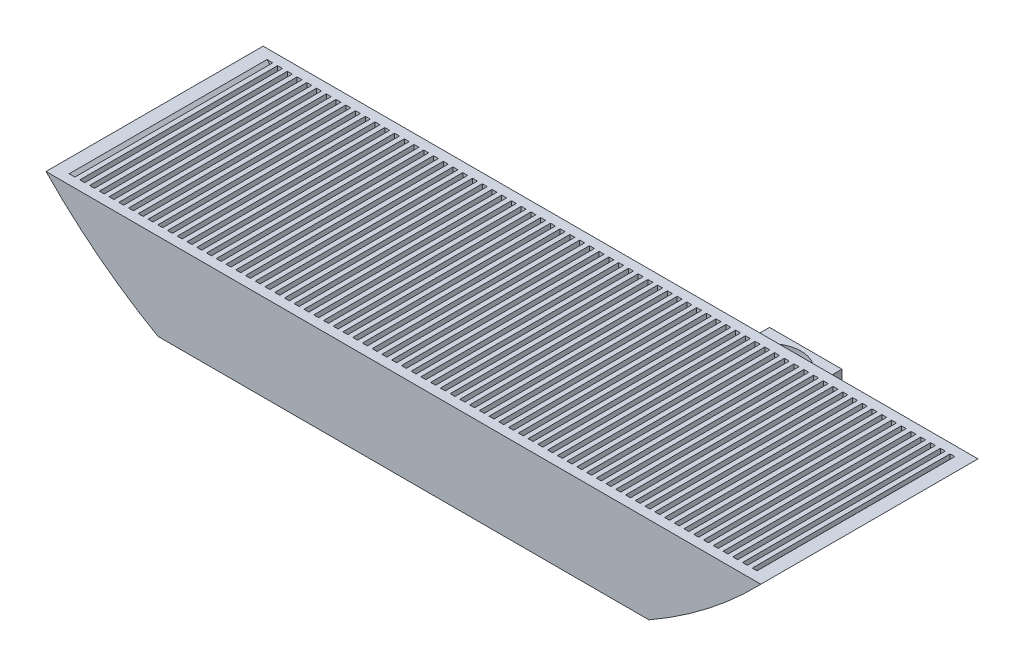
from build123d import *

# Parameters (mm, degrees)
BOSS_EXTRU_1_DEPTH         = 45
COQUE1_T                   = -2
BOSS_EXTRU_4_DEPTH         = 41
R_P_TITION_LIN_AIRE1_COUNT = 70
R_P_TITION_LIN_AIRE1_PITCH = 2.02
ESQUISSE3_W                = 15
ESQUISSE3_H                = 15
ESQUISSE3_R                = 6.5
BOSS_EXTRU_5_DEPTH         = 5
CONG_1_R                   = 0.25


with BuildPart() as part:
    # Esquisse1 → Boss.-Extru.1 (new body)
    with BuildSketch(Plane.XY):
        with BuildLine():
            Line((-50.330657344, -8.37745098), (51.422641976, -8.37745098))
            ThreePointArc((51.422641976, -8.37745098), (63.67142232, -0.208901476), (74.630455219, 9.62254902))
            Line((74.630455219, 9.62254902), (31.241812865, 9.62254902))
            Line((31.241812865, 9.62254902), (12.241812865, 9.62254902))
            Line((12.241812865, 9.62254902), (-73.538470588, 9.62254902))
            ThreePointArc((-73.538470588, 9.62254902), (-62.579437689, -0.208901476), (-50.330657344, -8.37745098))
        make_face()
    extrude(amount=BOSS_EXTRU_1_DEPTH)

    # Coque1
    coque1_openings = [part.faces().sort_by_distance(p)[0] for p in [
        (0.545992316, 9.62254902, 22.5),
        (0.545992316, -8.37745098, 22.5),
    ]]
    offset(amount=COQUE1_T, openings=coque1_openings, kind=Kind.INTERSECTION)

    # Esquisse2 → Boss.-Extru.4 (add)
    with BuildSketch(Plane.XY.offset(2)):
        with BuildLine():
            Line((-68.538470588, 9.62254902), (-69.538470588, 9.62254902))
            Line((-69.538470588, 9.62254902), (-69.538470588, 8.453497891))
            ThreePointArc((-69.538470588, 8.453497891), (-69.103392513, 8.036722078), (-68.665836017, 7.62254902))
            Line((-68.665836017, 7.62254902), (-68.538470588, 7.62254902))
            Line((-68.538470588, 7.62254902), (-68.538470588, 9.62254902))
        make_face()
    boss_extru_4 = extrude(amount=BOSS_EXTRU_4_DEPTH)

    # Répétition linéaire1: Boss.-Extru.4 ×70
    with Locations(*[(i * R_P_TITION_LIN_AIRE1_PITCH, 0, 0) for i in range(1, R_P_TITION_LIN_AIRE1_COUNT)]):
        add(boss_extru_4)

    # Esquisse3 → Boss.-Extru.5 (add)
    with BuildSketch(Plane.XZ.offset(8.37745098)):
        with Locations((23.922641976, -7.5)):
            Rectangle(ESQUISSE3_W, ESQUISSE3_H)
        with Locations(Location((23.922641976, -7.5, 0), (0, 0, 270))):
            Circle(ESQUISSE3_R, mode=Mode.SUBTRACT)
    extrude(amount=-BOSS_EXTRU_5_DEPTH)

    # Congé1
    cong_1_edges = [part.edges().sort_by_distance(p)[0] for p in [
        (23.922641976, -3.37745098, 0),
        (16.422641976, -5.87745098, 0),
        (31.422641976, -5.87745098, 0),
    ]]
    fillet(cong_1_edges, radius=CONG_1_R)


solid = part.part
